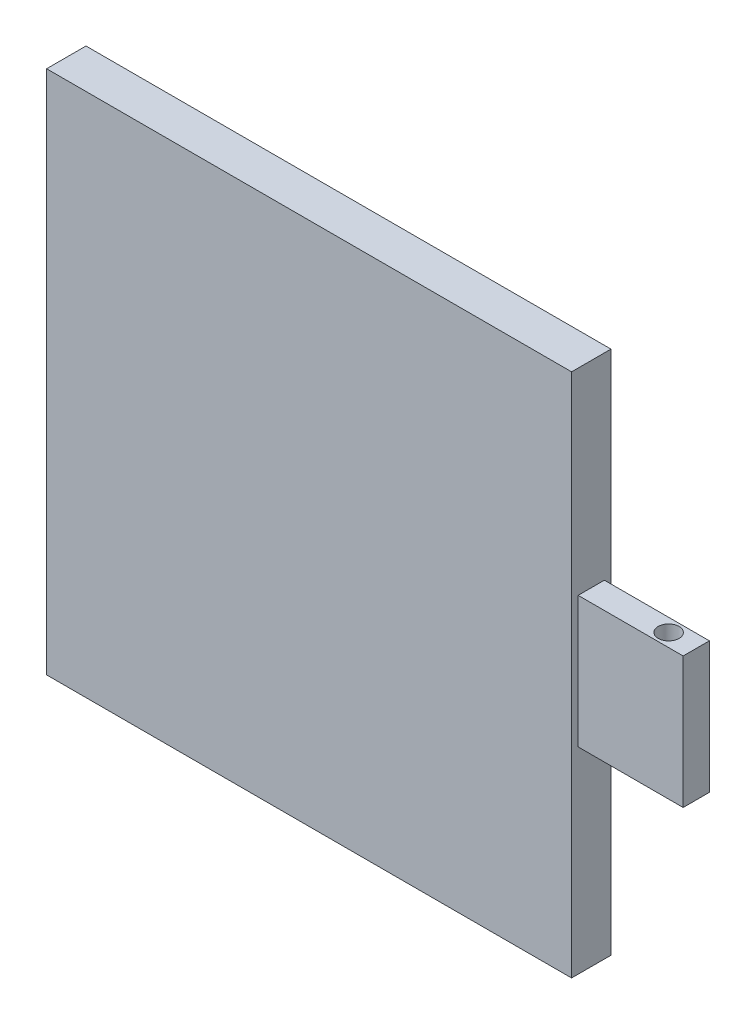
from build123d import *

# Parameters (mm, degrees)
SKETCH1_W           = 40
SKETCH1_H           = 40
BOSS_EXTRUDE1_DEPTH = 3
SKETCH6_W           = 2
SKETCH6_H           = 10
BOSS_EXTRUDE4_DEPTH = 8
CUT_EXTRUDE1_REACH  = 38.736
SKETCH7_R           = 0.794363795


with BuildPart() as part:
    # Sketch1 → Boss-Extrude1 (new body)
    with BuildSketch(Plane.XY):
        with Locations((-6.748971193, -0.452674897)):
            Rectangle(SKETCH1_W, SKETCH1_H)
    extrude(amount=BOSS_EXTRUDE1_DEPTH)

    # Sketch6 → Boss-Extrude4 (add)
    with BuildSketch(Plane(origin=(13.251028807, 0, 0), x_dir=(0, 0, -1), z_dir=(1, 0, 0))):
        with Locations((-1.5, -0.452674897)):
            Rectangle(SKETCH6_W, SKETCH6_H)
    extrude(amount=BOSS_EXTRUDE4_DEPTH)

    # Sketch7 → Cut-Extrude1 (cut, up to next)
    with BuildSketch(Plane.XZ.offset(5.452674897), mode=Mode.PRIVATE) as cut_extrude1_sk1:
        with Locations((19.145680917, 1.5)):
            Circle(SKETCH7_R)
    cut_extrude1_tool1 = extrude(cut_extrude1_sk1.sketch, amount=-CUT_EXTRUDE1_REACH, mode=Mode.PRIVATE) & part.part
    add(cut_extrude1_tool1.solids().sort_by_distance((19.145681, -5.452675, 1.5))[0], mode=Mode.SUBTRACT)


solid = part.part
